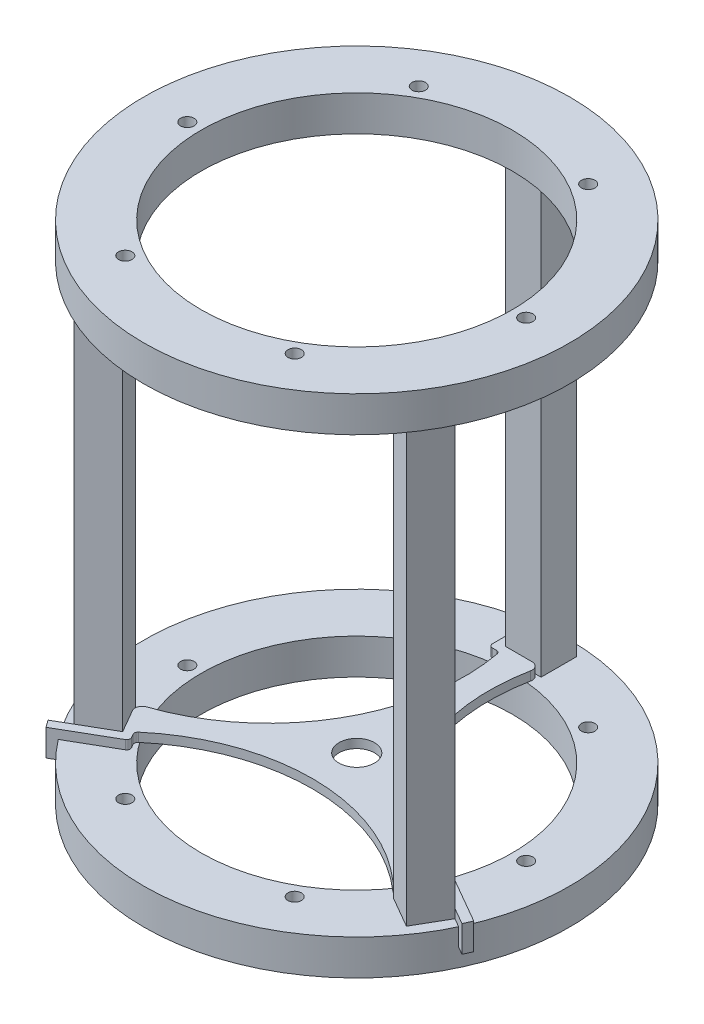
from build123d import *

# Parameters (mm, degrees)
SKETCH1_R                    = 76.2
SKETCH1_R_2                  = 2.413
BOSS_EXTRUDE1_DEPTH          = 12.7
BOSS_EXTRUDE2_DEPTH          = 155.575
BOSS_EXTRUDE3_START          = 12.7
SKETCH2_R                    = 76.2
SKETCH2_R_2                  = 2.413
SKETCH2_R_3                  = 55.6641
BOSS_EXTRUDE3_DEPTH          = 12.7
ALIGNMENT_PRINTED_PART_DEPTH = 3.175
BOSS_EXTRUDE6_START          = -6.35
BOSS_EXTRUDE6_DEPTH          = 6.35
SKETCH3_8_R                  = 6.35
CUT_EXTRUDE1_DEPTH           = 6.35
SKETCH4_R                    = 55.6641
CUT_EXTRUDE2_DEPTH           = 12.7


# Read off the part's stored shape, not the designer's step: Boss-Extrude6
with BuildPart() as part:
    # Sketch1 → Boss-Extrude1 (new body)
    with BuildSketch(Plane(origin=(0, 0, 0), x_dir=(1, 0, 0), z_dir=(0, 1, 0))):
        with Locations(Location((0, 0, 0), (0, 0, 270))):
            Circle(SKETCH1_R)
        with Locations(Location((30.3054258, 52.490537231, 0), (0, 0, 270))):
            Circle(SKETCH1_R_2, mode=Mode.SUBTRACT)
        with Locations(Location((60.6108516, 0, 0), (0, 0, 270))):
            Circle(SKETCH1_R_2, mode=Mode.SUBTRACT)
        with Locations(Location((30.3054258, -52.490537231, 0), (0, 0, 270))):
            Circle(SKETCH1_R_2, mode=Mode.SUBTRACT)
        with Locations(Location((-30.3054258, -52.490537231, 0), (0, 0, 270))):
            Circle(SKETCH1_R_2, mode=Mode.SUBTRACT)
        with Locations(Location((-60.6108516, 0, 0), (0, 0, 270))):
            Circle(SKETCH1_R_2, mode=Mode.SUBTRACT)
        with Locations(Location((-30.3054258, 52.490537231, 0), (0, 0, 270))):
            Circle(SKETCH1_R_2, mode=Mode.SUBTRACT)
    extrude(amount=-BOSS_EXTRUDE1_DEPTH)

    # Sketch4 → Cut-Extrude2 (cut)
    with BuildSketch(Plane(origin=(0, 0, 0), x_dir=(1, 0, 0), z_dir=(0, 1, 0))):
        with Locations(Location((0, 0, 0), (0, 0, 270))):
            Circle(SKETCH4_R)
    extrude(amount=-CUT_EXTRUDE2_DEPTH, mode=Mode.SUBTRACT)


with BuildPart() as body_2:
    # Sketch1<5> → Boss-Extrude2 (new body)
    # profile 1 of 4: a face of its own
    with BuildSketch(Plane(origin=(0, 0, 0), x_dir=(1, 0, 0), z_dir=(0, 1, 0))):
        Polygon((65.773091538, -30.641763686), (59.423091538, -41.640286314), (48.42456891, -35.290286314), (54.77456891, -24.291763686), align=None)
        Polygon((55.378876851, -26.547071628), (50.679876851, -34.685978372), (58.818783596, -39.384978372), (63.517783596, -31.246071628), align=None, mode=Mode.SUBTRACT)
    # profile 2 of 4: a face of its own
    with BuildSketch(Plane(origin=(0, 0, 0), x_dir=(1, 0, 0), z_dir=(0, 1, 0))):
        Polygon((-59.423091538, -41.640286314), (-65.773091538, -30.641763686), (-54.77456891, -24.291763686), (-48.42456891, -35.290286314), align=None)
        Polygon((-50.679876851, -34.685978372), (-55.378876851, -26.547071628), (-63.517783596, -31.246071628), (-58.818783596, -39.384978372), align=None, mode=Mode.SUBTRACT)
    # profile 3 of 4: a face of its own
    with BuildSketch(Plane(origin=(0, 0, 0), x_dir=(1, 0, 0), z_dir=(0, 1, 0))):
        Polygon((0, 61.23305), (0, 59.58205), (6.35, 59.58205), (6.35, 72.28205), (0, 72.28205), (0, 70.63105), (4.699, 70.63105), (4.699, 61.23305), align=None)
    # profile 4 of 4: a face of its own
    with BuildSketch(Plane(origin=(0, 0, 0), x_dir=(1, 0, 0), z_dir=(0, 1, 0))):
        Polygon((-6.35, 59.58205), (0, 59.58205), (0, 61.23305), (-4.699, 61.23305), (-4.699, 70.63105), (0, 70.63105), (0, 72.28205), (-6.35, 72.28205), align=None)
    extrude(amount=BOSS_EXTRUDE2_DEPTH)

    # Sketch2 → Boss-Extrude3 (add)
    with BuildSketch(Plane(origin=(0, 155.575, 0), x_dir=(1, 0, 0), z_dir=(0, 1, 0)).offset(BOSS_EXTRUDE3_START)):
        with Locations(Location((0, 0, 0), (0, 0, 270))):
            Circle(SKETCH2_R)
        with Locations(Location((30.3054258, -52.490537231, 0), (0, 0, 270))):
            Circle(SKETCH2_R_2, mode=Mode.SUBTRACT)
        with Locations(Location((-30.3054258, 52.490537231, 0), (0, 0, 270))):
            Circle(SKETCH2_R_2, mode=Mode.SUBTRACT)
        with Locations(Location((-60.6108516, 0, 0), (0, 0, 270))):
            Circle(SKETCH2_R_2, mode=Mode.SUBTRACT)
        with Locations(Location((-30.3054258, -52.490537231, 0), (0, 0, 270))):
            Circle(SKETCH2_R_2, mode=Mode.SUBTRACT)
        with Locations(Location((60.6108516, 0, 0), (0, 0, 270))):
            Circle(SKETCH2_R_2, mode=Mode.SUBTRACT)
        with Locations(Location((30.3054258, 52.490537231, 0), (0, 0, 270))):
            Circle(SKETCH2_R_2, mode=Mode.SUBTRACT)
        with Locations(Location((0, 0, 0), (0, 0, 270))):
            Circle(SKETCH2_R_3, mode=Mode.SUBTRACT)
    extrude(amount=-BOSS_EXTRUDE3_DEPTH)


with BuildPart() as body_3:
    # Sketch3 → Alignment printed part (new body)
    with BuildSketch(Plane(origin=(0, 0, 0), x_dir=(1, 0, 0), z_dir=(0, 1, 0))):
        with BuildLine():
            Line((50.004566484, -32.553650239), (54.77456891, -24.291763686))
            Line((54.77456891, -24.291763686), (71.695872062, -34.061282616))
            ThreePointArc((71.695872062, -34.061282616), (72.366041342, -32.613265777), (73.006969112, -31.152070642))
            Line((73.006969112, -31.152070642), (55.021261536, -20.768017531))
            ThreePointArc((55.021261536, -20.768017531), (54.057561349, -20.641143994), (53.286409273, -21.232869794))
            Line((53.286409273, -21.232869794), (52.545449715, -22.516249395))
            ThreePointArc((52.545449715, -22.516249395), (51.884861065, -23.072864886), (51.021049833, -23.07818687))
            ThreePointArc((51.021049833, -23.07818687), (13.539035771, 8.302223729), (5.68199232, 56.550523344))
            ThreePointArc((5.68199232, 56.550523344), (5.152156438, 58.654985568), (3.190004851, 59.58205))
            Line((3.190004851, 59.58205), (-6.35, 59.58205))
            Line((-6.35, 59.58205), (-6.35, 79.12108786))
            ThreePointArc((-6.35, 79.12108786), (-7.939104008, 78.977463062), (-9.525, 78.801925225))
            Line((-9.525, 78.801925225), (-9.525, 58.033819004))
            ThreePointArc((-9.525, 58.033819004), (-9.153025612, 57.135793392), (-8.255, 56.763819004))
            Line((-8.255, 56.763819004), (-6.773080883, 56.763819004))
            ThreePointArc((-6.773080883, 56.763819004), (-5.960743403, 56.470040197), (-5.524228814, 55.724618718))
            ThreePointArc((-5.524228814, 55.724618718), (-13.959454543, 7.574037056), (-51.815185973, -23.354511979))
            ThreePointArc((-51.815185973, -23.354511979), (-53.37278578, -24.865594424), (-53.194571335, -27.028399761))
            Line((-53.194571335, -27.028399761), (-48.42456891, -35.290286314))
            Line((-48.42456891, -35.290286314), (-65.345872062, -45.059805244))
            ThreePointArc((-65.345872062, -45.059805244), (-64.426937334, -46.364197285), (-63.481969112, -47.649854584))
            Line((-63.481969112, -47.649854584), (-45.496261536, -37.265801473))
            ThreePointArc((-45.496261536, -37.265801473), (-44.904535737, -36.494649397), (-45.031409273, -35.53094921))
            Line((-45.031409273, -35.53094921), (-45.772368831, -34.247569609))
            ThreePointArc((-45.772368831, -34.247569609), (-45.924117662, -33.397175311), (-45.496821019, -32.646431848))
            ThreePointArc((-45.496821019, -32.646431848), (0.420418772, -15.876260785), (46.133193653, -33.196011365))
            ThreePointArc((46.133193653, -33.196011365), (48.220629341, -33.789391144), (50.004566484, -32.553650239))
        make_face()
    extrude(amount=ALIGNMENT_PRINTED_PART_DEPTH)

    # Boss-Extrude6 outline → Boss-Extrude6 (add)
    with BuildSketch(Plane(origin=(0, 0, 0), x_dir=(1, 0, 0), z_dir=(0, 1, 0)).offset(BOSS_EXTRUDE6_START)):
        with BuildLine():
            ThreePointArc((70.236481421, -29.552528827), (69.602027548, -31.017302326), (68.937029978, -32.468464396))
            Line((68.937029978, -32.468464396), (71.695872062, -34.061282616))
            ThreePointArc((71.695872062, -34.061282616), (72.366041342, -32.613265777), (73.006969112, -31.152070642))
            Line((73.006969112, -31.152070642), (70.236481421, -29.552528827))
        make_face()
        with BuildLine():
            ThreePointArc((-6.35, 79.12108786), (-7.939104008, 78.977463062), (-9.525, 78.801925225))
            Line((-9.525, 78.801925225), (-9.525, 75.602841596))
            ThreePointArc((-9.525, 75.602841596), (-7.939242002, 75.785775175), (-6.35, 75.935451421))
            Line((-6.35, 75.935451421), (-6.35, 79.12108786))
        make_face()
        with BuildLine():
            ThreePointArc((-65.345872062, -45.059805244), (-64.426937334, -46.364197285), (-63.481969112, -47.649854584))
            Line((-63.481969112, -47.649854584), (-60.711481421, -46.050312769))
            ThreePointArc((-60.711481421, -46.050312769), (-61.662785546, -44.768472848), (-62.587029978, -43.466987024))
            Line((-62.587029978, -43.466987024), (-65.345872062, -45.059805244))
        make_face()
    extrude(amount=BOSS_EXTRUDE6_DEPTH)

    # Sketch3<8> → Cut-Extrude1 (cut)
    with BuildSketch(Plane(origin=(0, 0, 0), x_dir=(1, 0, 0), z_dir=(0, 1, 0))):
        with Locations(Location((0, 0, 0), (0, 0, 90))):
            Circle(SKETCH3_8_R)
    extrude(amount=CUT_EXTRUDE1_DEPTH, mode=Mode.SUBTRACT)


solid = Compound([part.part, body_2.part, body_3.part])
